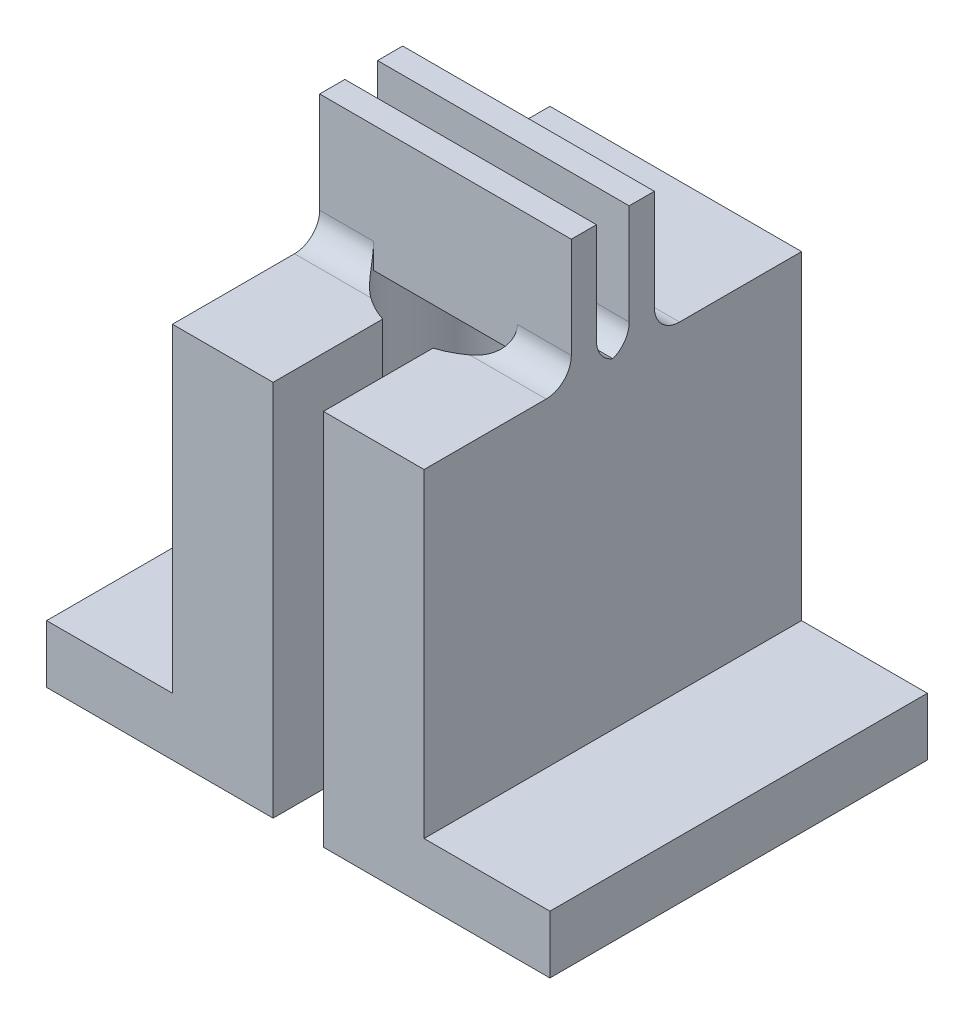
from build123d import *

# Parameters (mm, degrees)
SKETCH1_W           = 10
SKETCH1_H           = 15
BOSS_EXTRUDE1_DEPTH = 15
SKETCH3_W           = 5
SKETCH3_H           = 2.3
BOSS_EXTRUDE2_DEPTH = 15
SKETCH4_R           = 3.3
CUT_EXTRUDE1_DEPTH  = 24.452078799
SKETCH6_W           = 2
SKETCH6_H           = 15
CUT_EXTRUDE2_DEPTH  = 8
SKETCH7_W           = 10
SKETCH7_H           = 1
BOSS_EXTRUDE3_DEPTH = 5
FILLET1_R           = 1


with BuildPart() as part:
    # Sketch1 → Boss-Extrude1 (new body)
    with BuildSketch(Plane.XY):
        Rectangle(SKETCH1_W, SKETCH1_H)
    extrude(amount=BOSS_EXTRUDE1_DEPTH)

    # Sketch3 → Boss-Extrude2 (add)
    with BuildSketch(Plane.XY.offset(15)):
        with Locations((-7.5, -6.35)):
            Rectangle(SKETCH3_W, SKETCH3_H)
        with Locations((7.5, -6.35)):
            Rectangle(SKETCH3_W, SKETCH3_H)
    extrude(amount=-BOSS_EXTRUDE2_DEPTH)

    # Sketch4 → Cut-Extrude1 (cut, through all)
    with BuildSketch(Plane.XZ.offset(7.5)):
        with Locations(Location((0, 7.5, 0), (0, 0, 270))):
            Circle(SKETCH4_R)
    extrude(amount=-CUT_EXTRUDE1_DEPTH, mode=Mode.SUBTRACT)

    # Sketch6 → Cut-Extrude2 (cut)
    with BuildSketch(Plane.XY.offset(15)):
        Rectangle(SKETCH6_W, SKETCH6_H)
    extrude(amount=-CUT_EXTRUDE2_DEPTH, mode=Mode.SUBTRACT)

    # Sketch7 → Boss-Extrude3 (add)
    with BuildSketch(Plane(origin=(0, 7.5, 0), x_dir=(1, 0, 0), z_dir=(0, 1, 0))):
        with Locations((0, -8.65)):
            Rectangle(SKETCH7_W, SKETCH7_H)
        with Locations((0, -6.35)):
            Rectangle(SKETCH7_W, SKETCH7_H)
    extrude(amount=BOSS_EXTRUDE3_DEPTH)

    # Fillet1
    # the kernel refuses this fillet: 1 mm, written as the material it adds along each edge
    with BuildSketch(Plane(origin=(5, 7.5, 5.85), x_dir=(0, 0, -1), z_dir=(-1, 0, 0))) as fillet1_piece_1_section:
        with BuildLine():
            CenterArc((FILLET1_R, -FILLET1_R), FILLET1_R, 90, 90)
            Line((0, -FILLET1_R), (0, 0))
            Line((0, 0), (FILLET1_R, 0))
        make_face()
    fillet1_piece_1 = extrude(amount=4.642116168, mode=Mode.PRIVATE)
    fillet1_piece_1 = fillet1_piece_1 - Plane(origin=(0, 7.716795794, 7.5), x_dir=(0, 0, -1), z_dir=(0, -1, 0)) * Cylinder(3.3, 14, mode=Mode.PRIVATE)
    add(fillet1_piece_1)
    with BuildSketch(Plane(origin=(0.735351604, 7.5, 6.85), x_dir=(0, 0, 1), z_dir=(1, 0, 0))) as fillet1_piece_2_section:
        with BuildLine():
            CenterArc((FILLET1_R, -FILLET1_R), FILLET1_R, 90, 90)
            Line((0, -FILLET1_R), (0, 0))
            Line((0, 0), (FILLET1_R, 0))
        make_face()
    fillet1_piece_2 = extrude(amount=4.264648396, mode=Mode.PRIVATE)
    fillet1_piece_2 = fillet1_piece_2 - Plane(origin=(0, 7.724716743, 7.5), x_dir=(0, 0, -1), z_dir=(0, -1, 0)) * Cylinder(3.3, 13, mode=Mode.PRIVATE)
    add(fillet1_piece_2)
    with BuildSketch(Plane(origin=(-0.357883832, 7.5, 5.85), x_dir=(0, 0, -1), z_dir=(-1, 0, 0))) as fillet1_piece_3_section:
        with BuildLine():
            CenterArc((FILLET1_R, -FILLET1_R), FILLET1_R, 90, 90)
            Line((0, -FILLET1_R), (0, 0))
            Line((0, 0), (FILLET1_R, 0))
        make_face()
    fillet1_piece_3 = extrude(amount=4.642116168, mode=Mode.PRIVATE)
    fillet1_piece_3 = fillet1_piece_3 - Plane(origin=(0, 7.716795859, 7.5), x_dir=(0, 0, -1), z_dir=(0, -1, 0)) * Cylinder(3.3, 14, mode=Mode.PRIVATE)
    add(fillet1_piece_3)
    with BuildSketch(Plane(origin=(-5, 7.5, 6.85), x_dir=(0, 0, 1), z_dir=(1, 0, 0))) as fillet1_piece_4_section:
        with BuildLine():
            CenterArc((FILLET1_R, -FILLET1_R), FILLET1_R, 90, 90)
            Line((0, -FILLET1_R), (0, 0))
            Line((0, 0), (FILLET1_R, 0))
        make_face()
    fillet1_piece_4 = extrude(amount=4.264648396, mode=Mode.PRIVATE)
    fillet1_piece_4 = fillet1_piece_4 - Plane(origin=(0, 7.724717828, 7.5), x_dir=(0, 0, -1), z_dir=(0, -1, 0)) * Cylinder(3.3, 13, mode=Mode.PRIVATE)
    add(fillet1_piece_4)
    with BuildSketch(Plane(origin=(-0.735351604, 7.5, 8.15), x_dir=(0, 0, -1), z_dir=(-1, 0, 0))) as fillet1_piece_5_section:
        with BuildLine():
            CenterArc((FILLET1_R, -FILLET1_R), FILLET1_R, 90, 90)
            Line((0, -FILLET1_R), (0, 0))
            Line((0, 0), (FILLET1_R, 0))
        make_face()
    fillet1_piece_5 = extrude(amount=4.264648396, mode=Mode.PRIVATE)
    fillet1_piece_5 = fillet1_piece_5 - Plane(origin=(0, 7.724716743, 7.5), x_dir=(0, 0, -1), z_dir=(0, -1, 0)) * Cylinder(3.3, 13, mode=Mode.PRIVATE)
    add(fillet1_piece_5)
    with BuildSketch(Plane(origin=(5, 7.5, 8.15), x_dir=(0, 0, -1), z_dir=(-1, 0, 0))) as fillet1_piece_6_section:
        with BuildLine():
            CenterArc((FILLET1_R, -FILLET1_R), FILLET1_R, 90, 90)
            Line((0, -FILLET1_R), (0, 0))
            Line((0, 0), (FILLET1_R, 0))
        make_face()
    fillet1_piece_6 = extrude(amount=4.264648396, mode=Mode.PRIVATE)
    fillet1_piece_6 = fillet1_piece_6 - Plane(origin=(0, 7.724717828, 7.5), x_dir=(0, 0, -1), z_dir=(0, -1, 0)) * Cylinder(3.3, 13, mode=Mode.PRIVATE)
    add(fillet1_piece_6)
    with BuildSketch(Plane(origin=(-5, 7.5, 9.15), x_dir=(0, 0, 1), z_dir=(1, 0, 0))) as fillet1_piece_7_section:
        with BuildLine():
            CenterArc((FILLET1_R, -FILLET1_R), FILLET1_R, 90, 90)
            Line((0, -FILLET1_R), (0, 0))
            Line((0, 0), (FILLET1_R, 0))
        make_face()
    fillet1_piece_7 = extrude(amount=4.642116168, mode=Mode.PRIVATE)
    fillet1_piece_7 = fillet1_piece_7 - Plane(origin=(0, 7.716795794, 7.5), x_dir=(0, 0, -1), z_dir=(0, -1, 0)) * Cylinder(3.3, 14, mode=Mode.PRIVATE)
    add(fillet1_piece_7)
    with BuildSketch(Plane(origin=(0.357883832, 7.5, 9.15), x_dir=(0, 0, 1), z_dir=(1, 0, 0))) as fillet1_piece_8_section:
        with BuildLine():
            CenterArc((FILLET1_R, -FILLET1_R), FILLET1_R, 90, 90)
            Line((0, -FILLET1_R), (0, 0))
            Line((0, 0), (FILLET1_R, 0))
        make_face()
    fillet1_piece_8 = extrude(amount=4.642116168, mode=Mode.PRIVATE)
    fillet1_piece_8 = fillet1_piece_8 - Plane(origin=(0, 7.716795859, 7.5), x_dir=(0, 0, -1), z_dir=(0, -1, 0)) * Cylinder(3.3, 14, mode=Mode.PRIVATE)
    add(fillet1_piece_8)


solid = part.part
